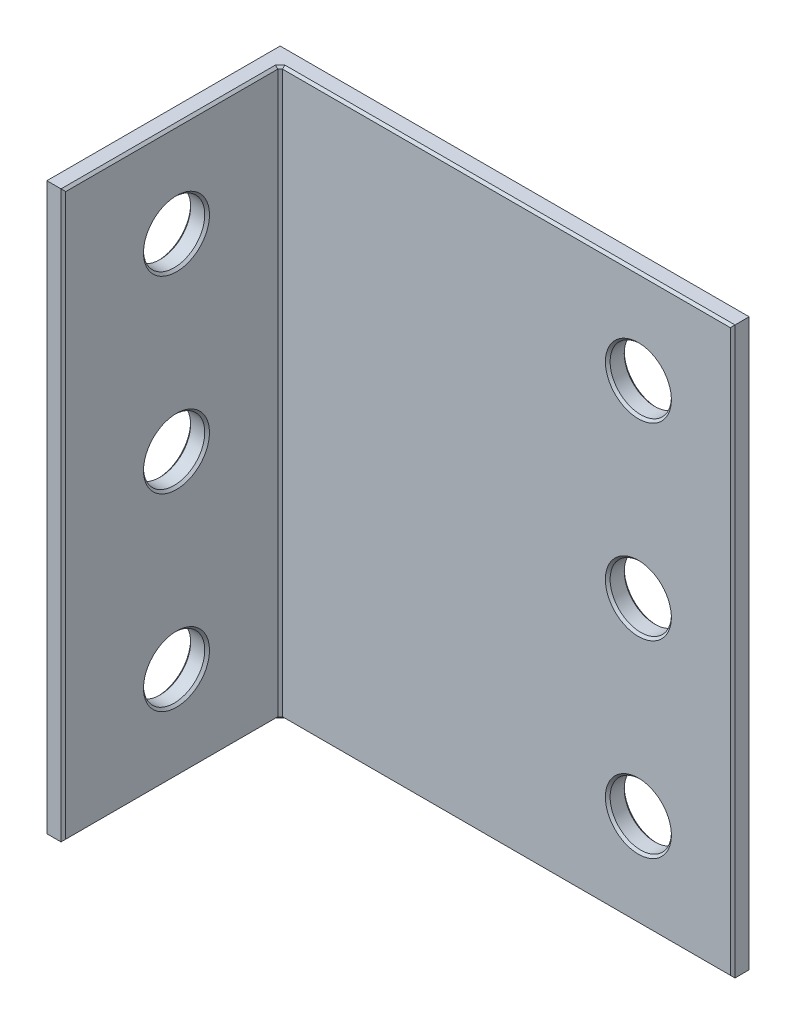
from build123d import *

# Parameters (mm, degrees)
SKETCH_1_W          = 200
SKETCH_1_H          = 240
SKETCH_1_R          = 13
EXTRUDE_378_DEPTH   = 8
SKETCH_2_W          = 8
SKETCH_2_H          = 240
EXTRUDE_1_DEPTH     = 92
SKETCH_3_R          = 13
CUT_EXTRUDE_1_DEPTH = 329.024389337
CHAMFER_1_SIZE      = 1


with BuildPart() as part:
    # 草图1 → Extrude 378 (new body)
    with BuildSketch(Plane.XY):
        with Locations((100, 120)):
            Rectangle(SKETCH_1_W, SKETCH_1_H)
        with Locations((160, 40)):
            Circle(SKETCH_1_R, mode=Mode.SUBTRACT)
        with Locations((160, 120)):
            Circle(SKETCH_1_R, mode=Mode.SUBTRACT)
        with Locations((160, 200)):
            Circle(SKETCH_1_R, mode=Mode.SUBTRACT)
    extrude(amount=EXTRUDE_378_DEPTH)

    # 草图2 → 凸台-拉伸1 (add)
    with BuildSketch(Plane.XY.offset(8)):
        with Locations((4, 120)):
            Rectangle(SKETCH_2_W, SKETCH_2_H)
    extrude(amount=EXTRUDE_1_DEPTH)

    # 草图3 → 切除-拉伸1 (cut, through all)
    with BuildSketch(Plane.ZY):
        with Locations((52, 200)):
            Circle(SKETCH_3_R)
        with Locations((52, 120)):
            Circle(SKETCH_3_R)
        with Locations((52, 40)):
            Circle(SKETCH_3_R)
    extrude(amount=-CUT_EXTRUDE_1_DEPTH, mode=Mode.SUBTRACT)

    # 倒角1
    chamfer_1_edges = [part.edges().sort_by_distance(p)[0] for p in [
        (147, 200, 0),
        (147, 40, 0),
        (147, 120, 0),
        (147, 120, 8),
        (147, 40, 8),
        (147, 200, 8),
        (100, 0, 0),
        (200, 120, 0),
        (100, 240, 0),
        (0, 240, 50),
        (0, 120, 100),
        (0, 0, 50),
        (0, 120, 0),
        (0, 200, 39),
        (0, 120, 39),
        (0, 40, 39),
        (104, 240, 8),
        (200, 120, 8),
        (104, 0, 8),
        (8, 0, 54),
        (8, 120, 100),
        (8, 240, 54),
        (8, 120, 8),
        (8, 200, 39),
        (8, 120, 39),
        (8, 40, 39),
    ]]
    chamfer(chamfer_1_edges, length=CHAMFER_1_SIZE)


solid = part.part
